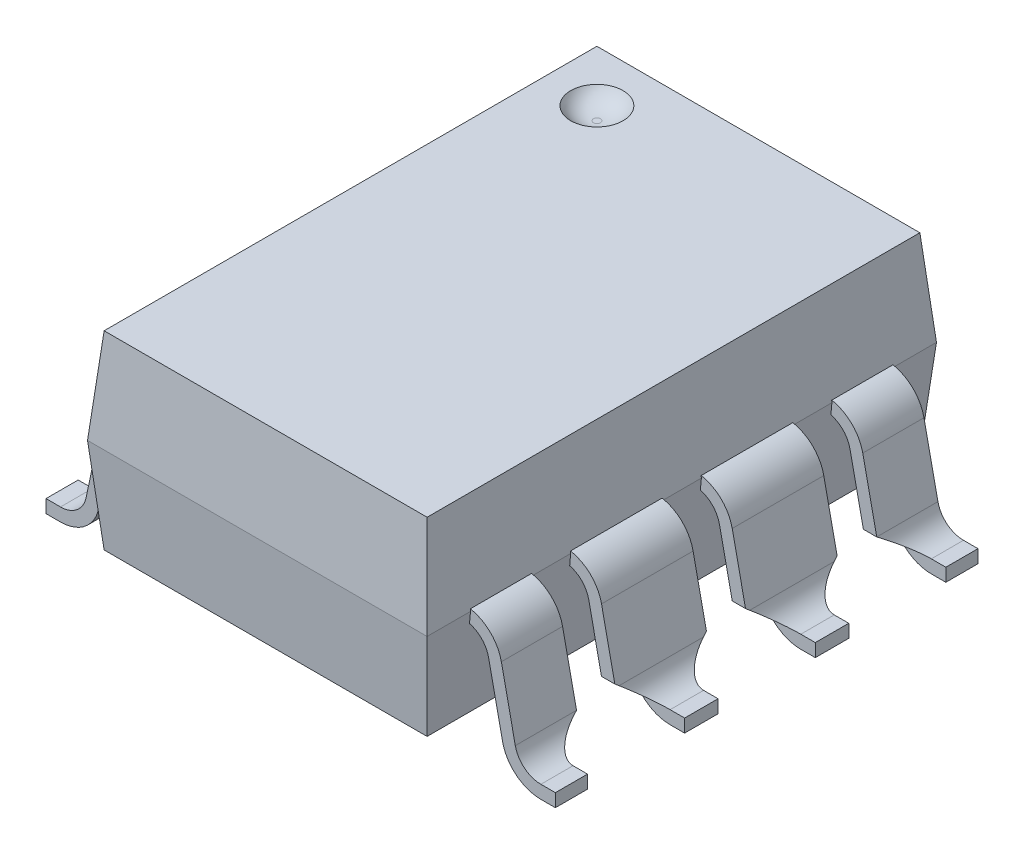
from build123d import *

# Parameters (mm, degrees)
SKETCH1_W                = 6.6
SKETCH1_H                = 9.9
EXTRUDE1_DEPTH           = 1.845
EXTRUDE1_TAPER           = 5
EXTRUDE1_OTHER_WAY_DEPTH = 1.845
EXTRUDE1_OTHER_WAY_TAPER = 5
EXTRUDE2_DEPTH           = 9.9
SKETCH4_W                = 14.472688398
SKETCH4_H                = 13.698747843
CUT_EXTRUDE1_DEPTH       = 15.218663861
SKETCH7_R                = 0.508
CUT_EXTRUDE4_DEPTH       = 0.254
FILLET1_R                = 0.508


with BuildPart() as part:
    # Sketch1 → Extrude1 (new body)
    with BuildSketch(Plane(origin=(0, 0, 0), x_dir=(1, 0, 0), z_dir=(0, 1, 0))):
        with Locations((3.3, -4.95)):
            Rectangle(SKETCH1_W, SKETCH1_H)
    extrude(amount=-EXTRUDE1_DEPTH, taper=EXTRUDE1_TAPER)

    # Sketch1 → Extrude1 other way (add)
    with BuildSketch(Plane(origin=(0, 0, 0), x_dir=(1, 0, 0), z_dir=(0, 1, 0))):
        with Locations((3.3, -4.95)):
            Rectangle(SKETCH1_W, SKETCH1_H)
    extrude(amount=EXTRUDE1_OTHER_WAY_DEPTH, taper=EXTRUDE1_OTHER_WAY_TAPER)

    # Sketch7 → Cut-Extrude4 (cut)
    with BuildSketch(Plane(origin=(0, 1.845, 0), x_dir=(1, 0, 0), z_dir=(0, 1, 0))):
        with Locations(Location((1.161416584, -1.161416584, 0), (0, 0, 270))):
            Circle(SKETCH7_R)
    extrude(amount=-CUT_EXTRUDE4_DEPTH, mode=Mode.SUBTRACT)

    # Fillet1
    # the kernel refuses this fillet: 0.508 mm, written as the material it adds along each edge
    with BuildSketch(Plane(origin=(1.161416584, 1.591, 1.161416584), x_dir=(0, 0, 1), z_dir=(-1, 0, 0))) as fillet1_piece_1:
        with BuildLine():
            CenterArc((0.068059095, 0.508), FILLET1_R, 270, 60)
            Line((0.068059095, 0), (0.068059095, -0.01016))
            Line((0.068059095, -0.01016), (0.508, -0.01016))
            Line((0.508, -0.01016), (0.51816, 0))
            ThreePointArc((0.51816, 0), (0.51816, 0.127), (0.516798818, 0.24892))
            Line((0.516798818, 0.24892), (0.508, 0.254))
        make_face()
    revolve(axis=Axis((1.161416584, 1.591, 1.161416584), (0, 1, 0)))


with BuildPart() as body_2:
    # Sketch2 → Extrude2 (new body)
    with BuildSketch(Plane(origin=(0, -0.430598518, 0), x_dir=(1, 0, 0), z_dir=(0, 0, 1))):
        with BuildLine():
            Line((0.145328065, 0.486598518), (6.454671935, 0.486598518))
            ThreePointArc((6.454671935, 0.486598518), (6.934214073, 0.316783741), (7.200020406, -0.116972773))
            Line((7.200020406, -0.116972773), (7.471252749, -1.393020621))
            ThreePointArc((7.471252749, -1.393020621), (7.648456972, -1.68219163), (7.968151731, -1.795401482))
            Line((7.968151731, -1.795401482), (8.25, -1.795401482))
            Line((8.25, -1.795401482), (8.25, -2.049401482))
            Line((8.25, -2.049401482), (7.968151731, -2.049401482))
            ThreePointArc((7.968151731, -2.049401482), (7.488609593, -1.879586704), (7.222803259, -1.44583019))
            Line((7.222803259, -1.44583019), (6.951570916, -0.169782343))
            ThreePointArc((6.951570916, -0.169782343), (6.774366693, 0.119388667), (6.454671935, 0.232598518))
            Line((6.454671935, 0.232598518), (0.145328065, 0.232598518))
            ThreePointArc((0.145328065, 0.232598518), (-0.174366693, 0.119388667), (-0.351570916, -0.169782343))
            Line((-0.351570916, -0.169782343), (-0.622803259, -1.44583019))
            ThreePointArc((-0.622803259, -1.44583019), (-0.888609593, -1.879586704), (-1.368151731, -2.049401482))
            Line((-1.368151731, -2.049401482), (-1.65, -2.049401482))
            Line((-1.65, -2.049401482), (-1.65, -1.795401482))
            Line((-1.65, -1.795401482), (-1.368151731, -1.795401482))
            ThreePointArc((-1.368151731, -1.795401482), (-1.048456972, -1.68219163), (-0.871252749, -1.393020621))
            Line((-0.871252749, -1.393020621), (-0.600020406, -0.116972773))
            ThreePointArc((-0.600020406, -0.116972773), (-0.334214073, 0.316783741), (0.145328065, 0.486598518))
        make_face()
    extrude(amount=EXTRUDE2_DEPTH)

    # Sketch4 → Cut-Extrude1 (cut, through all)
    with BuildSketch(Plane(origin=(8.25, 0, 0), x_dir=(0, 0, -1), z_dir=(1, 0, 0))):
        with Locations((-5.252892173, -2.360806544)):
            Rectangle(SKETCH4_W, SKETCH4_H)
        Polygon((-7.11, 0.056), (-5.33, 0.056), (-5.33, -1.767619139), (-5.895, -2.226), (-5.895, -2.730319947), (-6.545, -2.730319947), (-6.545, -2.226), (-7.11, -1.767619139), align=None, mode=Mode.SUBTRACT)
        Polygon((-4.005, -2.226), (-4.57, -1.767619139), (-4.57, 0.056), (-2.79, 0.056), (-2.79, -1.767619139), (-3.355, -2.226), (-3.355, -2.730319947), (-4.005, -2.730319947), align=None, mode=Mode.SUBTRACT)
        Polygon((-0.843, -2.730319947), (-0.843, 0.056), (-2.033, 0.056), (-2.033, -1.823619139), (-1.468, -2.226), (-1.468, -2.730319947), align=None, mode=Mode.SUBTRACT)
        Polygon((-9.057, 0.056), (-7.867, 0.056), (-7.867, -1.823619139), (-8.432, -2.226), (-8.432, -2.730319947), (-9.057, -2.730319947), align=None, mode=Mode.SUBTRACT)
    extrude(amount=-CUT_EXTRUDE1_DEPTH, mode=Mode.SUBTRACT)


with BuildPart() as cut_extrude1_piece_1:
    # of the separate pieces the step leaves, piece 1, a body of its own (cut_extrude1_pieces)
    add(body_2.part.solids().sort_by_distance((-1.368151731, -2.226, 5.895))[0])


with BuildPart() as cut_extrude1_piece_2:
    # of the separate pieces the step leaves, piece 2, a body of its own (cut_extrude1_pieces)
    add(body_2.part.solids().sort_by_distance((-1.368151731, -2.226, 3.355))[0])


with BuildPart() as cut_extrude1_piece_3:
    # of the separate pieces the step leaves, piece 3, a body of its own (cut_extrude1_pieces)
    add(body_2.part.solids().sort_by_distance((-1.368151731, -2.226, 0.843))[0])


with BuildPart() as cut_extrude1_piece_4:
    # of the separate pieces the step leaves, piece 4, a body of its own (cut_extrude1_pieces)
    add(body_2.part.solids().sort_by_distance((-1.368151731, -2.226, 8.432))[0])


solid = Compound([part.part, cut_extrude1_piece_1.part, cut_extrude1_piece_2.part, cut_extrude1_piece_3.part, cut_extrude1_piece_4.part])
